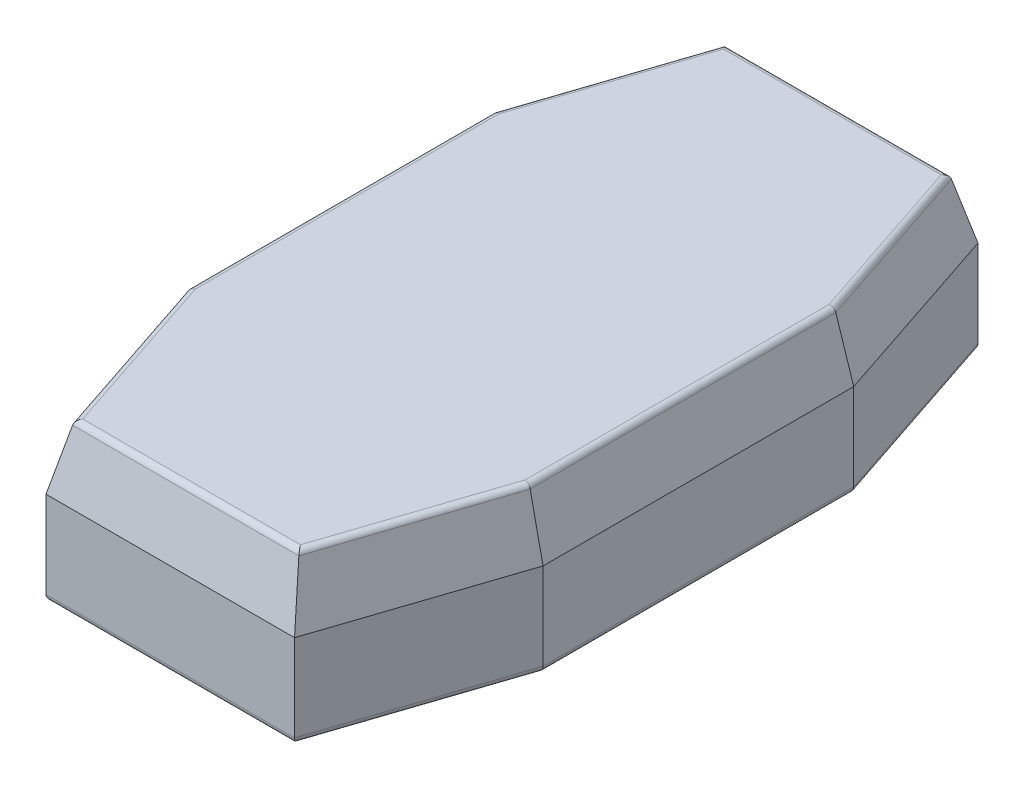
from build123d import *

# Parameters (mm, degrees)
BOSS_EXTRUDE1_DEPTH = 2.54
BOSS_EXTRUDE1_TAPER = 15
BOSS_EXTRUDE2_DEPTH = 3.8
FILLET2_R           = 0.1
CHAMFER1_SIZE       = 0.2
BOSS_EXTRUDE3_DEPTH = 3.8
FILLET3_R           = 0.25
FILLET5_R           = 0.5
FILLET6_R           = 0.1
FILLET7_R           = 0.25


with BuildPart() as part:
    # Sketch1 → Boss-Extrude1 (new body)
    with BuildSketch(Plane(origin=(0, 0, 0), x_dir=(1, 0, 0), z_dir=(0, 1, 0))):
        Polygon((-7.62, 6.35), (-7.62, -6.35), (-5.08, -13.97), (5.08, -13.97), (7.62, -6.35), (7.62, 6.35), (5.08, 13.97), (-5.08, 13.97), align=None)
    extrude(amount=BOSS_EXTRUDE1_DEPTH, taper=BOSS_EXTRUDE1_TAPER)

    # Stem → Boss-Extrude2 (add)
    with BuildSketch(Plane.XZ):
        with BuildLine():
            Line((2.499999969, 2.5), (-2.499999969, 2.5))
            ThreePointArc((-2.499999969, 2.5), (-2.85355336, 2.353553391), (-2.999999969, 2))
            Line((-2.999999969, 2), (-2.999999969, -2))
            ThreePointArc((-2.999999969, -2), (-2.85355336, -2.353553391), (-2.499999969, -2.5))
            Line((-2.499999969, -2.5), (2.499999969, -2.5))
            ThreePointArc((2.499999969, -2.5), (2.85355336, -2.353553391), (2.999999969, -2))
            Line((2.999999969, -2), (2.999999969, 2))
            ThreePointArc((2.999999969, 2), (2.85355336, 2.353553391), (2.499999969, 2.5))
        make_face()
        Polygon((-0.5625, 0.6625), (-0.5625, 2.075), (0.5625, 2.075), (0.5625, 0.6625), (2.0625, 0.6625), (2.0625, -0.6625), (0.5625, -0.6625), (0.5625, -2.075), (-0.5625, -2.075), (-0.5625, -0.6625), (-2.0625, -0.6625), (-2.0625, 0.6625), align=None, mode=Mode.SUBTRACT)
    extrude(amount=BOSS_EXTRUDE2_DEPTH)

    # Fillet2
    fillet2_edges = [part.edges().sort_by_distance(p)[0] for p in [
        (-2.85355336, -3.8, -2.353553391),
        (-2.999999969, -3.8, 0),
        (-2.85355336, -3.8, 2.353553391),
        (0, -3.8, 2.5),
        (2.85355336, -3.8, 2.353553391),
        (2.999999969, -3.8, 0),
        (2.85355336, -3.8, -2.353553391),
        (0, -3.8, -2.5),
    ]]
    fillet(fillet2_edges, radius=FILLET2_R)

    # Chamfer1
    chamfer1_edges = [part.edges().sort_by_distance(p)[0] for p in [
        (-0.5625, -3.8, -1.36875),
        (-1.3125, -3.8, -0.6625),
        (-2.0625, -3.8, 0),
        (0.5625, -3.8, -1.36875),
        (1.3125, -3.8, -0.6625),
        (2.0625, -3.8, 0),
        (1.3125, -3.8, 0.6625),
        (0.5625, -3.8, 1.36875),
        (0, -3.8, 2.075),
        (-0.5625, -3.8, 1.36875),
        (-1.3125, -3.8, 0.6625),
    ]]
    chamfer(chamfer1_edges, length=CHAMFER1_SIZE)

    # Sketch3 → Boss-Extrude3 (add)
    with BuildSketch(Plane.XZ):
        Polygon((-7.62, 6.35), (-7.62, -6.35), (-5.08, -13.97), (5.08, -13.97), (7.62, -6.35), (7.62, 6.35), (5.08, 13.97), (-5.08, 13.97), align=None)
        Polygon((-6.35, -6.143907372), (-4.164635791, -12.7), (4.164635791, -12.7), (6.35, -6.143907372), (6.35, 6.143907372), (4.164635791, 12.7), (-4.164635791, 12.7), (-6.35, 6.143907372), align=None, mode=Mode.SUBTRACT)
    extrude(amount=BOSS_EXTRUDE3_DEPTH)

    # Fillet3
    fillet3_edges = [part.edges().sort_by_distance(p)[0] for p in [
        (0, -3.8, -12.7),
        (5.257317895, -3.8, -9.421953686),
        (6.35, -3.8, 0),
        (5.257317895, -3.8, 9.421953686),
        (0, -3.8, 12.7),
        (-5.257317895, -3.8, 9.421953686),
        (-6.35, -3.8, 0),
        (-5.257317895, -3.8, -9.421953686),
        (0, -3.8, 13.97),
        (6.35, -3.8, 10.16),
        (7.62, -3.8, 0),
        (6.35, -3.8, -10.16),
        (0, -3.8, -13.97),
        (-6.35, -3.8, -10.16),
        (-7.62, -3.8, 0),
        (-6.35, -3.8, 10.16),
    ]]
    fillet(fillet3_edges, radius=FILLET3_R)

    # Fillet5
    fillet5_edges = [part.edges().sort_by_distance(p)[0] for p in [
        (0, 0, 2.5),
        (-2.85355336, 0, 2.353553391),
        (-2.999999969, 0, 0),
        (-2.85355336, 0, -2.353553391),
        (0, 0, -2.5),
        (2.85355336, 0, -2.353553391),
        (2.999999969, 0, 0),
        (2.85355336, 0, 2.353553391),
        (-5.257317895, 0, 9.421953686),
        (0, 0, 12.7),
        (5.257317895, 0, 9.421953686),
        (6.35, 0, 0),
        (5.257317895, 0, -9.421953686),
        (0, 0, -12.7),
        (-5.257317895, 0, -9.421953686),
        (-6.35, 0, 0),
    ]]
    fillet(fillet5_edges, radius=FILLET5_R)

    # Fillet6
    fillet6_edges = [part.edges().sort_by_distance(p)[0] for p in [
        (-1.3125, 0, 0.6625),
        (-0.5625, 0, 1.36875),
        (0, 0, 2.075),
        (0.5625, 0, 1.36875),
        (1.3125, 0, 0.6625),
        (2.0625, 0, 0),
        (1.3125, 0, -0.6625),
        (0.5625, 0, -1.36875),
        (0, 0, -2.075),
        (-0.5625, 0, -1.36875),
        (-1.3125, 0, -0.6625),
        (-2.0625, 0, 0),
    ]]
    fillet(fillet6_edges, radius=FILLET6_R)

    # Fillet7
    fillet7_edges = [part.edges().sort_by_distance(p)[0] for p in [
        (5.764433425, 2.54, -9.764482172),
        (6.939409051, 2.54, 0),
        (5.764433425, 2.54, 9.764482172),
        (0, 2.54, 13.289409051),
        (-5.764433425, 2.54, 9.764482172),
        (-6.939409051, 2.54, 0),
        (-5.764433425, 2.54, -9.764482172),
        (0, 2.54, -13.289409051),
    ]]
    fillet(fillet7_edges, radius=FILLET7_R)


solid = part.part
